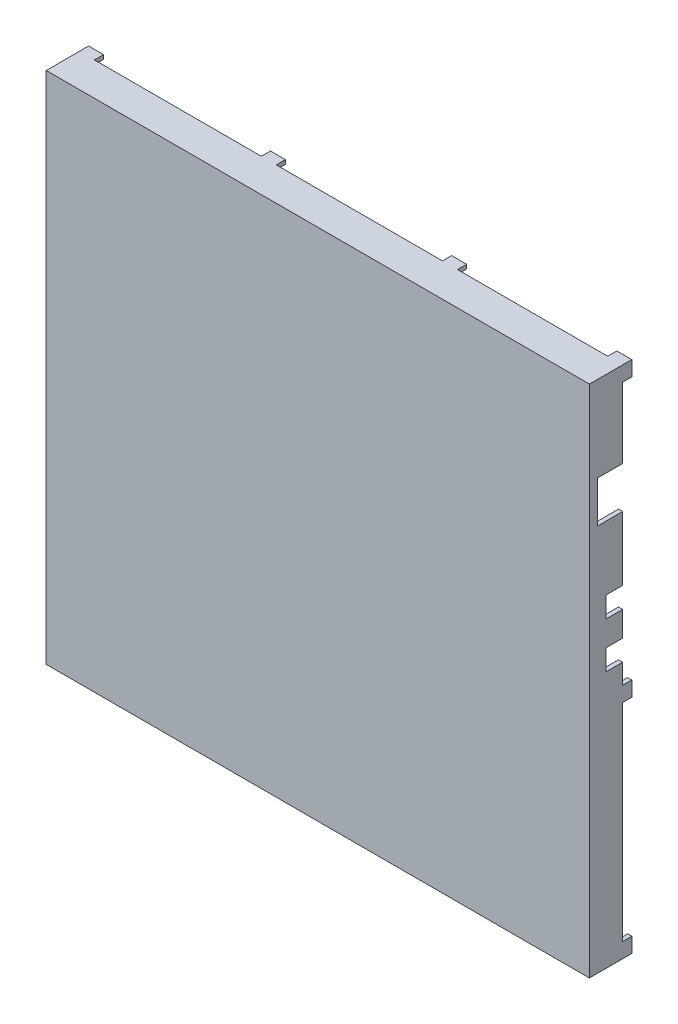
from build123d import *

# Parameters (mm, degrees)
SKETCH_1_W               = 65.34
SKETCH_1_H               = 61.875
EXTRUDE_1_DEPTH          = 5.1
CUT_EXTRUDE_1_DEPTH      = 0.5
SKETCH_2_3_W             = 1.1
SKETCH_2_3_H             = 24.9
CUT_EXTRUDE_2_DEPTH      = 0.5
SKETCH_3_OUTSIDE_W       = 85.366
SKETCH_3_OUTSIDE_H       = 81.901
SKETCH_3_OUTSIDE_W_2     = 65.34
SKETCH_3_OUTSIDE_H_2     = 61.875
SKETCH_3_OUTSIDE_W_3     = 64.34
SKETCH_3_OUTSIDE_H_3     = 60.88
CUT_EXTRUDE_4_DEPTH      = 5
CUT_EXTRUDE_6_DEPTH      = 91.13235393
CUT_EXTRUDE_6_DEPTH_BACK = 91.13235393
CUT_EXTRUDE_7_DEPTH      = 91.13235393
CUT_EXTRUDE_7_DEPTH_BACK = 0.6
CUT_EXTRUDE_START        = -0.5
CUT_EXTRUDE_8_OUTLINE_W  = 2
CUT_EXTRUDE_8_OUTLINE_H  = 2.5
CUT_EXTRUDE_8_DEPTH      = 0.5


# Read off the part's stored shape, not the designer's step: 切除-拉伸8
with BuildPart() as part:
    # 草图1 → 凸台-拉伸1 (new body)
    with BuildSketch(Plane.XY):
        with Locations((32.67, 30.9375)):
            Rectangle(SKETCH_1_W, SKETCH_1_H)
    extrude(amount=EXTRUDE_1_DEPTH)

    # 草图2 → 切除-拉伸1 (cut)
    with BuildSketch(Plane(origin=(65.34, 0, 0), x_dir=(0, 0, -1), z_dir=(1, 0, 0))):
        Polygon((0, 28.5), (0, 60.075), (-1.1, 60.075), (-1.1, 51.6), (-4.1, 51.6), (-4.1, 46.6), (-1.1, 46.6), (-1.1, 28.5), align=None)
    extrude(amount=-CUT_EXTRUDE_1_DEPTH, mode=Mode.SUBTRACT)

    # 草图2<3> → 切除-拉伸2 (cut)
    with BuildSketch(Plane(origin=(65.34, 0, 0), x_dir=(0, 0, -1), z_dir=(1, 0, 0))):
        with Locations((-0.55, 14.25)):
            Rectangle(SKETCH_2_3_W, SKETCH_2_3_H)
    extrude(amount=-CUT_EXTRUDE_2_DEPTH, mode=Mode.SUBTRACT)

    # 草图3 outside → 切除-拉伸4 (cut)
    # profile 1 of 2: a face of its own
    with BuildSketch(Plane(origin=(0, 0, 0), x_dir=(-1, 0, 0), z_dir=(0, 0, -1))):
        with Locations((-32.67, 30.9375)):
            Rectangle(SKETCH_3_OUTSIDE_W, SKETCH_3_OUTSIDE_H)
        with Locations((-32.67, 30.9375)):
            Rectangle(SKETCH_3_OUTSIDE_W_2, SKETCH_3_OUTSIDE_H_2, mode=Mode.SUBTRACT)
    # profile 2 of 2: a face of its own
    with BuildSketch(Plane(origin=(0, 0, 0), x_dir=(-1, 0, 0), z_dir=(0, 0, -1))):
        with Locations((-32.67, 30.94)):
            Rectangle(SKETCH_3_OUTSIDE_W_3, SKETCH_3_OUTSIDE_H_3)
    extrude(amount=-CUT_EXTRUDE_4_DEPTH, mode=Mode.SUBTRACT)

    # 草图6 → 切除-拉伸6 (cut, two sides: drawn at the far end of the back side and taken through both)
    with BuildSketch(Plane(origin=(0, 0, 0), x_dir=(1, 0, 0), z_dir=(0, 1, 0)).offset(-CUT_EXTRUDE_6_DEPTH_BACK)):
        Polygon((-141.077467171, 0), (0, 0), (1.8, 0), (1.8, -1.1), (21.875, -1.1), (21.875, 0), (23.675, 0), (23.675, -1.1), (43.675, -1.1), (43.675, 0), (45.475, 0), (45.475, -1.1), (63.54, -1.1), (63.54, 0), (65.34, 0), (206.417467171, 0), (206.417467171, 282.154934342), (-141.077467171, 282.154934342), align=None)
    extrude(amount=CUT_EXTRUDE_6_DEPTH + CUT_EXTRUDE_6_DEPTH_BACK, mode=Mode.SUBTRACT)

    # 草图13 → 切除-拉伸7 (cut, two sides: drawn at the far end of the back side and taken through both)
    with BuildSketch(Plane.ZY.offset(-CUT_EXTRUDE_7_DEPTH_BACK)):
        Polygon((1.1, 60.075), (0, 60.075), (0, 1.8), (1.1, 1.8), (1.1, 10.6), (4.1, 10.6), (4.1, 35.075), (1.1, 35.075), align=None)
    extrude(amount=CUT_EXTRUDE_7_DEPTH + CUT_EXTRUDE_7_DEPTH_BACK, mode=Mode.SUBTRACT)

    # 切除-拉伸8 outline → 切除-拉伸8 (cut)
    with BuildSketch(Plane(origin=(65.34, 0, 0), x_dir=(0, 0, -1), z_dir=(1, 0, 0)).offset(CUT_EXTRUDE_START)):
        with Locations((-2.1, 32.15)):
            Rectangle(CUT_EXTRUDE_8_OUTLINE_W, CUT_EXTRUDE_8_OUTLINE_H)
        with Locations((-2.1, 37.65)):
            Rectangle(CUT_EXTRUDE_8_OUTLINE_W, CUT_EXTRUDE_8_OUTLINE_H)
    extrude(amount=CUT_EXTRUDE_8_DEPTH, mode=Mode.SUBTRACT)


solid = part.part
